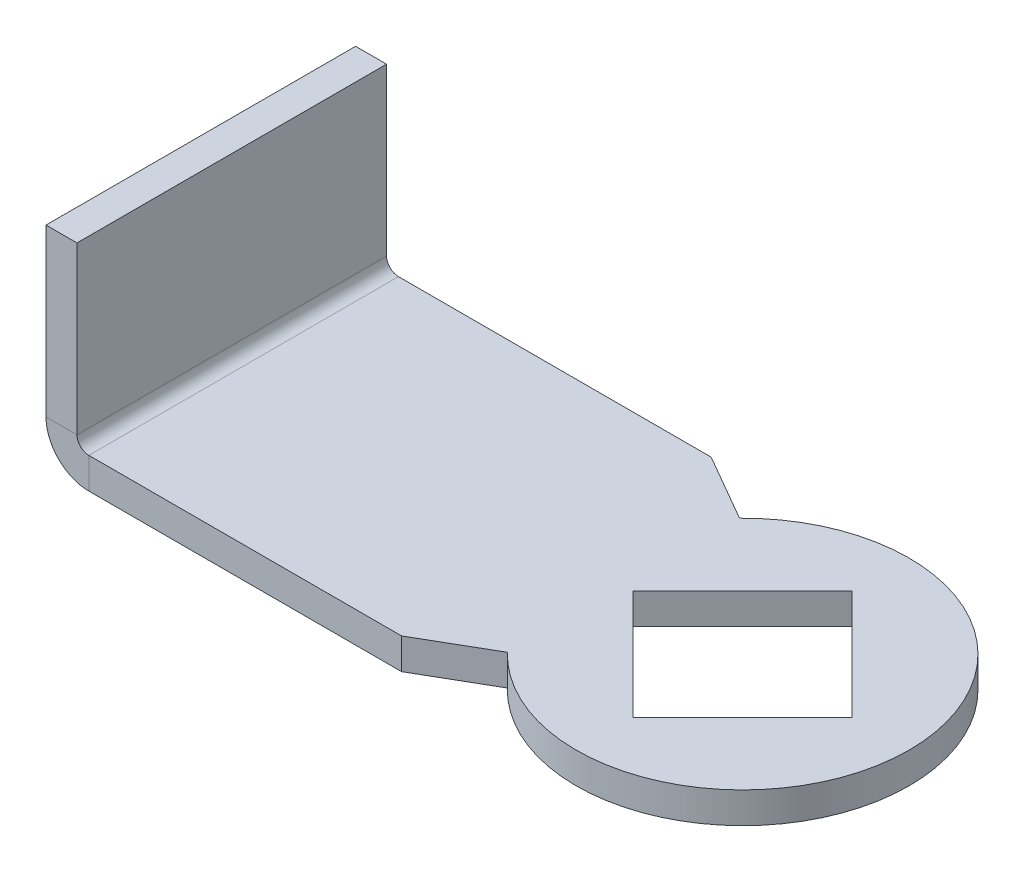
from build123d import *

# Parameters (mm, degrees)
SM_BASE_FLANGE_1_DEPTH           = 2
SM_EDGE_FLANGE_1_STRIP_W         = 9.5332
SM_EDGE_FLANGE_1_STRIP_H         = 2
SM_EDGE_FLANGE_1_STRIP_CUT_DEPTH = 20
SM_EDGE_FLANGE_1_DEPTH           = 20
CUT_EXTRUDE_1_DEPTH              = 57.15881498


# Sheet-metal steps are written as plain solids
with BuildPart() as part:
    # Sketch 2 → 基体-法兰1 (new body)
    with BuildSketch(Plane(origin=(0, 0, 0), x_dir=(1, 0, 0), z_dir=(0, 1, 0))):
        with BuildLine():
            Line((-30.031587919, -10), (-25.7014609, -7.5))
            ThreePointArc((-25.7014609, -7.5), (-7.25, 0), (-25.7014609, 7.5))
            Line((-25.7014609, 7.5), (-30.031587919, 10))
            Line((-30.031587919, 10), (-53, 10))
            Line((-53, 10), (-53, -10))
            Line((-53, -10), (-30.031587919, -10))
        make_face()
    extrude(amount=-SM_BASE_FLANGE_1_DEPTH)

    # 边线-法兰1 strip (across the edge) → 边线-法兰1 strip cut (cut)
    with BuildSketch(Plane(origin=(-53, 0, -10), x_dir=(1, 0, 0), z_dir=(0, 0, 1))):
        with Locations((-2, -1)):
            Rectangle(SM_EDGE_FLANGE_1_STRIP_W, SM_EDGE_FLANGE_1_STRIP_H)
    extrude(amount=SM_EDGE_FLANGE_1_STRIP_CUT_DEPTH, mode=Mode.SUBTRACT)

    # 边线-法兰1 section (across the edge) → 边线-法兰1 (add)
    with BuildSketch(Plane(origin=(-53, 0, -10), x_dir=(1, 0, 0), z_dir=(0, 0, 1))):
        with BuildLine():
            Line((0, 0.7666), (0, 11.5))
            Line((0, 11.5), (2, 11.5))
            Line((2, 11.5), (2, 0.7666))
            ThreePointArc((2, 0.7666), (2.224531942, 0.224531942), (2.7666, 0))
            Line((2.7666, 0), (2.7666, -2))
            ThreePointArc((2.7666, -2), (0.810318379, -1.189681621), (0, 0.7666))
        make_face()
    extrude(amount=SM_EDGE_FLANGE_1_DEPTH)

    # 草图10 → 切除-拉伸1 (cut, through all)
    with BuildSketch(Plane(origin=(0, -2, -2), x_dir=(1, 0, 0), z_dir=(0, 1, 0))):
        Polygon((-18, 5.071067812), (-25.071067812, -2), (-18, -9.071067812), (-10.928932188, -2), align=None)
    extrude(amount=CUT_EXTRUDE_1_DEPTH, mode=Mode.SUBTRACT)


solid = part.part
